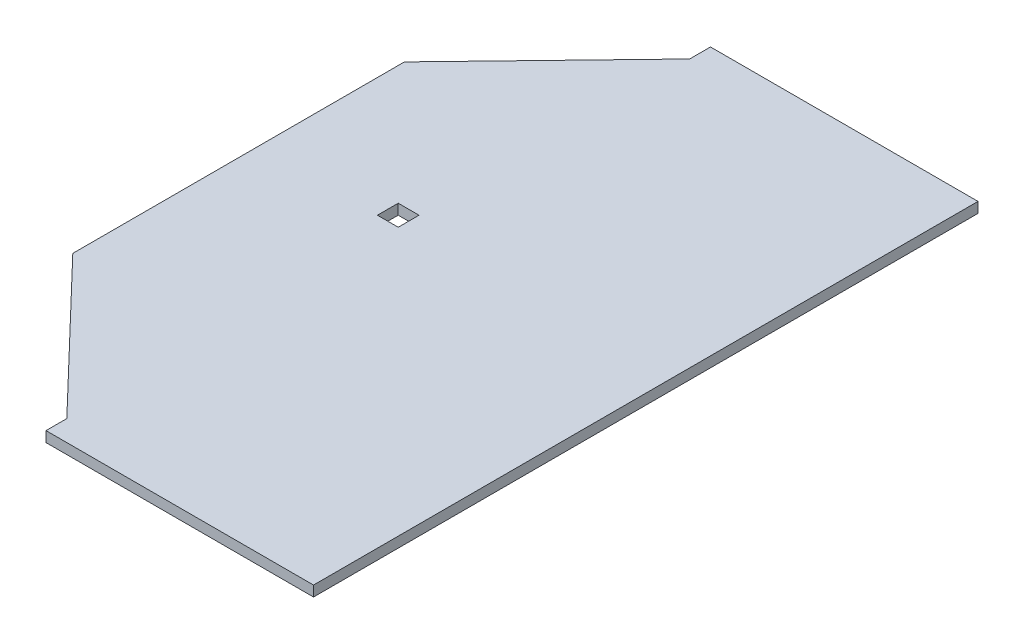
from build123d import *

# Parameters (mm, degrees)
BOSS_EXTRUDE2_DEPTH = 10
SKETCH4_W           = 20
SKETCH4_H           = 20
CUT_EXTRUDE1_DEPTH  = 10


with BuildPart() as part:
    # Sketch1 → Boss-Extrude2 (new body)
    with BuildSketch(Plane(origin=(0, 0, 0), x_dir=(1, 0, 0), z_dir=(0, 1, 0))):
        Polygon((0, 0), (257, 0), (257, 638.38), (0, 638.38), (0, 618.38), (-134.58, 478.90585262), (-134.58, 319.61085262), (-134.58, 160.31585262), (0, 20), align=None)
    extrude(amount=BOSS_EXTRUDE2_DEPTH)

    # Sketch4 → Cut-Extrude1 (cut)
    with BuildSketch(Plane(origin=(0, 10, 0), x_dir=(1, 0, 0), z_dir=(0, 1, 0))):
        with Locations((-10, 348.38)):
            Rectangle(SKETCH4_W, SKETCH4_H)
    extrude(amount=-CUT_EXTRUDE1_DEPTH, mode=Mode.SUBTRACT)


solid = part.part
